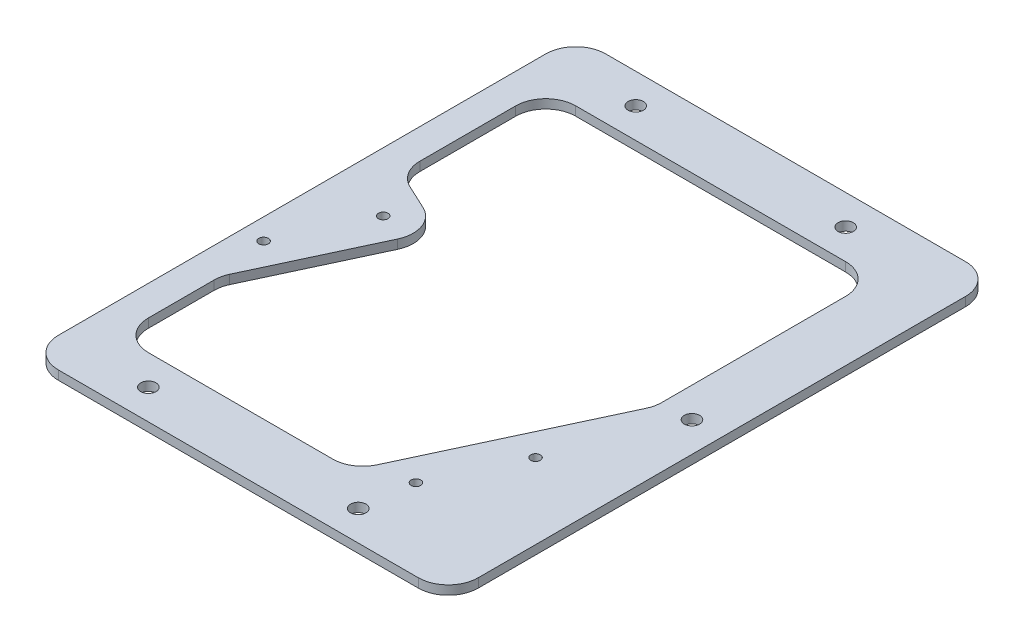
from build123d import *

# Parameters (mm, degrees)
SKETCH_1_W          = 140
SKETCH_1_H          = 182.5
SKETCH_1_R          = 2.55
EXTRUDE_1_DEPTH     = 3
FILLET_1_R          = 10
SKETCH_2_R          = 1.6
CUT_EXTRUDE_1_DEPTH = 116.045914747
CUT_EXTRUDE_2_DEPTH = 116.045914747
FILLET_2_R          = 10


with BuildPart() as part:
    # ｽｹｯﾁ1 → ﾎﾞｽ - 押し出し1 (new body)
    with BuildSketch(Plane(origin=(0, 0, 0), x_dir=(1, 0, 0), z_dir=(0, 1, 0))):
        Rectangle(SKETCH_1_W, SKETCH_1_H)
        with Locations((-40, 81.25)):
            Circle(SKETCH_1_R, mode=Mode.SUBTRACT)
        with Locations((30, 81.25)):
            Circle(SKETCH_1_R, mode=Mode.SUBTRACT)
        with Locations((60, 0)):
            Circle(SKETCH_1_R, mode=Mode.SUBTRACT)
        with Locations((-40, -81.25)):
            Circle(SKETCH_1_R, mode=Mode.SUBTRACT)
        with Locations((30, -81.25)):
            Circle(SKETCH_1_R, mode=Mode.SUBTRACT)
    extrude(amount=EXTRUDE_1_DEPTH)

    # ﾌｨﾚｯﾄ1
    fillet_1_edges = [part.edges().sort_by_distance(p)[0] for p in [
        (-70, 1.5, -91.25),
        (70, 1.5, -91.25),
        (-70, 1.5, 91.25),
        (70, 1.5, 91.25),
    ]]
    fillet(fillet_1_edges, radius=FILLET_1_R)

    # ｽｹｯﾁ2 → ｶｯﾄ - 押し出し1 (cut, through all)
    with BuildSketch(Plane(origin=(0, 3, 0), x_dir=(1, 0, 0), z_dir=(0, 1, 0))):
        with Locations((-50.304962764, 7.366722093)):
            Circle(SKETCH_2_R)
        with Locations((-62.983510616, -19.822511518)):
            Circle(SKETCH_2_R)
        with Locations((44.857354875, -37.008195389)):
            Circle(SKETCH_2_R)
        with Locations((32.178807023, -64.197429)):
            Circle(SKETCH_2_R)
    extrude(amount=-CUT_EXTRUDE_1_DEPTH, mode=Mode.SUBTRACT)

    # ｽｹｯﾁ3 → ｶｯﾄ - 押し出し2 (cut, through all)
    with BuildSketch(Plane(origin=(0, 3, 0), x_dir=(1, 0, 0), z_dir=(0, 1, 0))):
        Polygon((-60, 71.25), (50, 71.25), (50, -2.317741498), (17.856359967, -71.25), (-60, -71.25), (-60, -37.086368186), (-37.015702276, 12.203617346), (-60, 22.921371393), align=None)
    extrude(amount=-CUT_EXTRUDE_2_DEPTH, mode=Mode.SUBTRACT)

    # ﾌｨﾚｯﾄ2
    fillet_2_edges = [part.edges().sort_by_distance(p)[0] for p in [
        (50, 1.5, 2.317741498),
        (17.856359967, 1.5, 71.25),
        (-60, 1.5, 71.25),
        (-60, 1.5, 37.086368186),
        (-37.015702276, 1.5, -12.203617346),
        (-60, 1.5, -22.921371393),
        (50, 1.5, -71.25),
        (-60, 1.5, -71.25),
    ]]
    fillet(fillet_2_edges, radius=FILLET_2_R)


solid = part.part
